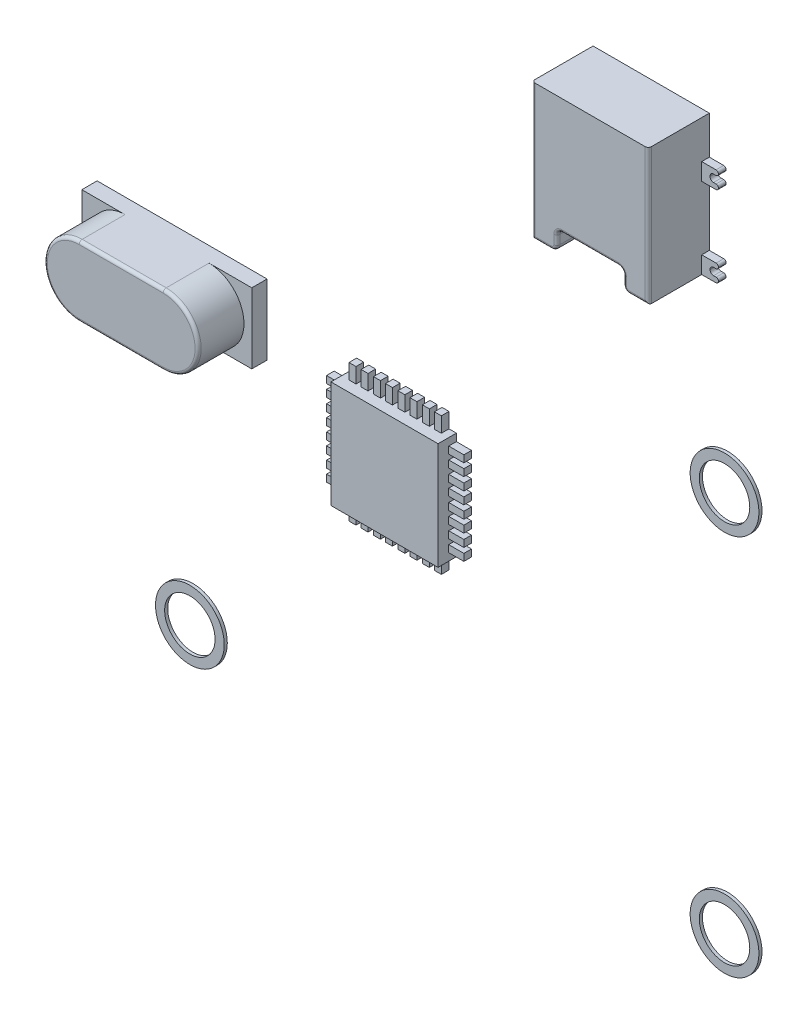
from build123d import *

# Parameters (mm, degrees)
AUFSATZ_LINEAR_AUSTRAGEN1_DEPTH       = 1
AUFSATZ_LINEAR_AUSTRAGEN2_DEPTH       = 4
AUFSATZ_LINEAR_AUSTRAGEN3_OUTLINE_W   = 0.4572
AUFSATZ_LINEAR_AUSTRAGEN3_OUTLINE_H   = 0.9906
AUFSATZ_LINEAR_AUSTRAGEN3_OUTLINE_W_2 = 0.9906
AUFSATZ_LINEAR_AUSTRAGEN3_OUTLINE_H_2 = 0.4572
AUFSATZ_LINEAR_AUSTRAGEN3_DEPTH       = 0.5
AUFSATZ_LINEAR_AUSTRAGEN4_DEPTH       = 1.2
AUFSATZ_LINEAR_AUSTRAGEN5_DEPTH       = 4
VERRUNDUNG1_R                         = 0.2
VERRUNDUNG2_R                         = 0.2
MODEL_7_R                             = 2.25
MODEL_7_R_2                           = 1.65
AUFSATZ_LINEAR_AUSTRAGEN6_DEPTH       = 0.2
AUFSATZ_LINEAR_AUSTRAGEN6_2_DEPTH     = 0.2
AUFSATZ_LINEAR_AUSTRAGEN6_3_DEPTH     = 0.2


# Read off the part's stored shape, not the designer's step: Aufsatz-Linear austragen1, Aufsatz-Linear austragen3
with BuildPart() as part:
    # Aufsatz-Linear austragen1 outline → Aufsatz-Linear austragen1 (new body)
    with BuildSketch(Plane.XY):
        with BuildLine():
            Line((24.854, 26.938), (22.054, 26.938))
            ThreePointArc((22.054, 26.938), (24.341533967, 24.638), (22.054, 22.338))
            Line((22.054, 22.338), (24.854, 22.338))
            Line((24.854, 22.338), (24.854, 26.938))
        make_face()
        with BuildLine():
            Line((13.729, 22.338), (16.554, 22.338))
            ThreePointArc((16.554, 22.338), (14.266466033, 24.638), (16.554, 26.938))
            Line((16.554, 26.938), (13.729, 26.938))
            Line((13.729, 26.938), (13.729, 22.338))
        make_face()
    extrude(amount=AUFSATZ_LINEAR_AUSTRAGEN1_DEPTH)

    # Model<3> → Aufsatz-Linear austragen2 (add)
    with BuildSketch(Plane.XY):
        with BuildLine():
            Line((22.054, 26.938), (16.579, 26.938))
            ThreePointArc((16.579, 26.938), (14.2665, 24.6505), (16.554, 22.338))
            Line((16.554, 22.338), (22.029, 22.338))
            ThreePointArc((22.029, 22.338), (24.3415, 24.6255), (22.054, 26.938))
        make_face()
    extrude(amount=AUFSATZ_LINEAR_AUSTRAGEN2_DEPTH)

    # Verrundung1
    verrundung1_edges = [part.edges().sort_by_distance(p)[0] for p in [
        (19.2915, 22.338, 4),
        (19.3165, 26.938, 4),
        (24.3415, 24.6255, 4),
        (14.2665, 24.6505, 4),
    ]]
    fillet(verrundung1_edges, radius=VERRUNDUNG1_R)


with BuildPart() as body_2:
    # Aufsatz-Linear austragen3 outline → Aufsatz-Linear austragen3 (new body)
    with BuildSketch(Plane.XY):
        with BuildLine():
            Line((53.8059, 48.3197), (53.8059, 47.1982))
            Line((53.8059, 47.1982), (54.7311, 47.1982))
            ThreePointArc((54.7311, 47.1982), (54.850032958, 47.247464518), (54.8993, 47.36639643))
            ThreePointArc((54.8993, 47.36639643), (54.854136082, 47.475433558), (54.7451, 47.5206))
            Line((54.7451, 47.5206), (54.5769, 47.5206))
            ThreePointArc((54.5769, 47.5206), (54.418241395, 47.586241395), (54.3526, 47.7449))
            Line((54.3526, 47.7449), (54.3526, 47.773))
            ThreePointArc((54.3526, 47.773), (54.418241395, 47.931658605), (54.5769, 47.9973))
            Line((54.5769, 47.9973), (54.7311, 47.9973))
            ThreePointArc((54.7311, 47.9973), (54.849998859, 48.04653043), (54.899299968, 48.1654))
            ThreePointArc((54.899299968, 48.1654), (54.854313056, 48.274712931), (54.7451, 48.3197))
            Line((54.7451, 48.3197), (53.8059, 48.3197))
        make_face()
        with BuildLine():
            ThreePointArc((54.5769, 42.2354), (54.418263825, 42.301063825), (54.3526, 42.4597))
            Line((54.3526, 42.4597), (54.3526, 42.4878))
            ThreePointArc((54.3526, 42.4878), (54.41829747, 42.64640253), (54.5769, 42.7121))
            Line((54.5769, 42.7121), (54.7311, 42.7121))
            ThreePointArc((54.7311, 42.7121), (54.85003422, 42.76136578), (54.8993, 42.8803))
            ThreePointArc((54.8993, 42.8803), (54.854251149, 42.989451149), (54.7451, 43.0345))
            Line((54.7451, 43.0345), (53.8059, 43.0345))
            Line((53.8059, 43.0345), (53.8059, 41.9131))
            Line((53.8059, 41.9131), (54.7311, 41.913))
            ThreePointArc((54.7311, 41.913), (54.850032958, 41.962264518), (54.8993, 42.08119643))
            ThreePointArc((54.8993, 42.08119643), (54.854136082, 42.190233558), (54.7451, 42.2354))
            Line((54.7451, 42.2354), (54.5769, 42.2354))
        make_face()
        with Locations((30.946, 16.8895)):
            Rectangle(AUFSATZ_LINEAR_AUSTRAGEN3_OUTLINE_W, AUFSATZ_LINEAR_AUSTRAGEN3_OUTLINE_H)
        with Locations((34.1464, 16.8895)):
            Rectangle(AUFSATZ_LINEAR_AUSTRAGEN3_OUTLINE_W, AUFSATZ_LINEAR_AUSTRAGEN3_OUTLINE_H)
        with Locations((35.7466, 16.8895)):
            Rectangle(AUFSATZ_LINEAR_AUSTRAGEN3_OUTLINE_W, AUFSATZ_LINEAR_AUSTRAGEN3_OUTLINE_H)
        with Locations((36.534, 16.8895)):
            Rectangle(AUFSATZ_LINEAR_AUSTRAGEN3_OUTLINE_W, AUFSATZ_LINEAR_AUSTRAGEN3_OUTLINE_H)
        with Locations((34.9338, 16.8895)):
            Rectangle(AUFSATZ_LINEAR_AUSTRAGEN3_OUTLINE_W, AUFSATZ_LINEAR_AUSTRAGEN3_OUTLINE_H)
        with Locations((33.3336, 16.8895)):
            Rectangle(AUFSATZ_LINEAR_AUSTRAGEN3_OUTLINE_W, AUFSATZ_LINEAR_AUSTRAGEN3_OUTLINE_H)
        with Locations((32.5462, 16.8895)):
            Rectangle(AUFSATZ_LINEAR_AUSTRAGEN3_OUTLINE_W, AUFSATZ_LINEAR_AUSTRAGEN3_OUTLINE_H)
        with Locations((31.7334, 16.8895)):
            Rectangle(AUFSATZ_LINEAR_AUSTRAGEN3_OUTLINE_W, AUFSATZ_LINEAR_AUSTRAGEN3_OUTLINE_H)
        with Locations((30.946, 24.8905)):
            Rectangle(AUFSATZ_LINEAR_AUSTRAGEN3_OUTLINE_W, AUFSATZ_LINEAR_AUSTRAGEN3_OUTLINE_H)
        with BuildLine():
            Line((46.1936, 47.1983), (46.1936, 48.317097005))
            Line((46.1936, 48.317097005), (45.268182624, 48.317097005))
            ThreePointArc((45.268182624, 48.317097005), (45.149245887, 48.267832602), (45.09997873, 48.148897005))
            ThreePointArc((45.09997873, 48.148897005), (45.14514391, 48.039862185), (45.25417873, 47.994697005))
            Line((45.25417873, 47.994697005), (45.42237873, 47.994697005))
            ThreePointArc((45.42237873, 47.994697005), (45.581014905, 47.92903318), (45.64667873, 47.770397005))
            Line((45.64667873, 47.770397005), (45.64667873, 47.742297005))
            ThreePointArc((45.64667873, 47.742297005), (45.58107098, 47.583604755), (45.42237873, 47.517997005))
            Line((45.42237873, 47.517997005), (45.26817873, 47.517997005))
            ThreePointArc((45.26817873, 47.517997005), (45.100864756, 47.365112576), (45.254296106, 47.1983))
            Line((45.254296106, 47.1983), (46.1936, 47.1983))
        make_face()
        with BuildLine():
            Line((46.1936, 41.9131), (46.1936, 43.0346))
            Line((46.1936, 43.0346), (45.2683, 43.0346))
            ThreePointArc((45.2683, 43.0346), (45.14936578, 42.98533422), (45.1001, 42.8664))
            ThreePointArc((45.1001, 42.8664), (45.14526518, 42.75736518), (45.2543, 42.7122))
            Line((45.2543, 42.7122), (45.4225, 42.7122))
            ThreePointArc((45.4225, 42.7122), (45.58110253, 42.64650253), (45.6468, 42.4879))
            Line((45.6468, 42.4879), (45.6468, 42.4598))
            ThreePointArc((45.6468, 42.4598), (45.58119225, 42.30110775), (45.4225, 42.2355))
            Line((45.4225, 42.2355), (45.2683, 42.2355))
            ThreePointArc((45.2683, 42.2355), (45.14936578, 42.18623422), (45.1001, 42.0673))
            ThreePointArc((45.1001, 42.0673), (45.145118035, 41.958118035), (45.2543, 41.9131))
            Line((45.2543, 41.9131), (46.1936, 41.9131))
        make_face()
        with Locations((29.7395, 20.4836)):
            Rectangle(AUFSATZ_LINEAR_AUSTRAGEN3_OUTLINE_W_2, AUFSATZ_LINEAR_AUSTRAGEN3_OUTLINE_H_2)
        with Locations((29.7395, 19.6962)):
            Rectangle(AUFSATZ_LINEAR_AUSTRAGEN3_OUTLINE_W_2, AUFSATZ_LINEAR_AUSTRAGEN3_OUTLINE_H_2)
        with Locations((29.7395, 18.8834)):
            Rectangle(AUFSATZ_LINEAR_AUSTRAGEN3_OUTLINE_W_2, AUFSATZ_LINEAR_AUSTRAGEN3_OUTLINE_H_2)
        with Locations((29.7395, 18.096)):
            Rectangle(AUFSATZ_LINEAR_AUSTRAGEN3_OUTLINE_W_2, AUFSATZ_LINEAR_AUSTRAGEN3_OUTLINE_H_2)
        with Locations((29.7395, 21.2964)):
            Rectangle(AUFSATZ_LINEAR_AUSTRAGEN3_OUTLINE_W_2, AUFSATZ_LINEAR_AUSTRAGEN3_OUTLINE_H_2)
        with Locations((29.7395, 22.0838)):
            Rectangle(AUFSATZ_LINEAR_AUSTRAGEN3_OUTLINE_W_2, AUFSATZ_LINEAR_AUSTRAGEN3_OUTLINE_H_2)
        with Locations((29.7395, 23.684)):
            Rectangle(AUFSATZ_LINEAR_AUSTRAGEN3_OUTLINE_W_2, AUFSATZ_LINEAR_AUSTRAGEN3_OUTLINE_H_2)
        with Locations((29.7395, 22.8966)):
            Rectangle(AUFSATZ_LINEAR_AUSTRAGEN3_OUTLINE_W_2, AUFSATZ_LINEAR_AUSTRAGEN3_OUTLINE_H_2)
        with Locations((37.7405, 20.4836)):
            Rectangle(AUFSATZ_LINEAR_AUSTRAGEN3_OUTLINE_W_2, AUFSATZ_LINEAR_AUSTRAGEN3_OUTLINE_H_2)
        with Locations((37.7405, 19.6962)):
            Rectangle(AUFSATZ_LINEAR_AUSTRAGEN3_OUTLINE_W_2, AUFSATZ_LINEAR_AUSTRAGEN3_OUTLINE_H_2)
        with Locations((37.7405, 18.8834)):
            Rectangle(AUFSATZ_LINEAR_AUSTRAGEN3_OUTLINE_W_2, AUFSATZ_LINEAR_AUSTRAGEN3_OUTLINE_H_2)
        with Locations((37.7405, 18.096)):
            Rectangle(AUFSATZ_LINEAR_AUSTRAGEN3_OUTLINE_W_2, AUFSATZ_LINEAR_AUSTRAGEN3_OUTLINE_H_2)
        with Locations((37.7405, 21.2964)):
            Rectangle(AUFSATZ_LINEAR_AUSTRAGEN3_OUTLINE_W_2, AUFSATZ_LINEAR_AUSTRAGEN3_OUTLINE_H_2)
        with Locations((37.7405, 22.0838)):
            Rectangle(AUFSATZ_LINEAR_AUSTRAGEN3_OUTLINE_W_2, AUFSATZ_LINEAR_AUSTRAGEN3_OUTLINE_H_2)
        with Locations((37.7405, 23.684)):
            Rectangle(AUFSATZ_LINEAR_AUSTRAGEN3_OUTLINE_W_2, AUFSATZ_LINEAR_AUSTRAGEN3_OUTLINE_H_2)
        with Locations((37.7405, 22.8966)):
            Rectangle(AUFSATZ_LINEAR_AUSTRAGEN3_OUTLINE_W_2, AUFSATZ_LINEAR_AUSTRAGEN3_OUTLINE_H_2)
        with Locations((31.7334, 24.8905)):
            Rectangle(AUFSATZ_LINEAR_AUSTRAGEN3_OUTLINE_W, AUFSATZ_LINEAR_AUSTRAGEN3_OUTLINE_H)
        with Locations((32.5462, 24.8905)):
            Rectangle(AUFSATZ_LINEAR_AUSTRAGEN3_OUTLINE_W, AUFSATZ_LINEAR_AUSTRAGEN3_OUTLINE_H)
        with Locations((33.3336, 24.8905)):
            Rectangle(AUFSATZ_LINEAR_AUSTRAGEN3_OUTLINE_W, AUFSATZ_LINEAR_AUSTRAGEN3_OUTLINE_H)
        with Locations((34.1464, 24.8905)):
            Rectangle(AUFSATZ_LINEAR_AUSTRAGEN3_OUTLINE_W, AUFSATZ_LINEAR_AUSTRAGEN3_OUTLINE_H)
        with Locations((34.9338, 24.8905)):
            Rectangle(AUFSATZ_LINEAR_AUSTRAGEN3_OUTLINE_W, AUFSATZ_LINEAR_AUSTRAGEN3_OUTLINE_H)
        with Locations((35.7466, 24.8905)):
            Rectangle(AUFSATZ_LINEAR_AUSTRAGEN3_OUTLINE_W, AUFSATZ_LINEAR_AUSTRAGEN3_OUTLINE_H)
        with Locations((36.534, 24.8905)):
            Rectangle(AUFSATZ_LINEAR_AUSTRAGEN3_OUTLINE_W, AUFSATZ_LINEAR_AUSTRAGEN3_OUTLINE_H)
    extrude(amount=AUFSATZ_LINEAR_AUSTRAGEN3_DEPTH)

    # Model<5> → Aufsatz-Linear austragen4 (add)
    with BuildSketch(Plane.XY):
        Polygon((30.2348, 17.8674), (30.2348, 17.3848), (30.7174, 17.3848), (31.1746, 17.3848), (31.5048, 17.3848), (31.962, 17.3848), (32.3176, 17.3848), (32.7748, 17.3848), (33.105, 17.3848), (33.5622, 17.3848), (33.9178, 17.3848), (34.375, 17.3848), (34.7052, 17.3848), (35.1624, 17.3848), (35.518, 17.3848), (35.9752, 17.3848), (36.3054, 17.3848), (36.7626, 17.3848), (37.2452, 17.3848), (37.2452, 17.8674), (37.2452, 18.3246), (37.2452, 18.6548), (37.2452, 19.112), (37.2452, 19.4676), (37.2452, 19.9248), (37.2452, 20.255), (37.2452, 20.7122), (37.2452, 21.0678), (37.2452, 21.525), (37.2452, 21.8552), (37.2452, 22.3124), (37.2452, 22.668), (37.2452, 23.1252), (37.2452, 23.4554), (37.2452, 23.9126), (37.2452, 24.3952), (36.7626, 24.3952), (36.3054, 24.3952), (35.9752, 24.3952), (35.518, 24.3952), (35.1624, 24.3952), (34.7052, 24.3952), (34.375, 24.3952), (33.9178, 24.3952), (33.5622, 24.3952), (33.105, 24.3952), (32.7748, 24.3952), (32.3176, 24.3952), (31.962, 24.3952), (31.5048, 24.3952), (31.1746, 24.3952), (30.7174, 24.3952), (30.2348, 24.3952), (30.2348, 23.9126), (30.2348, 23.4554), (30.2348, 23.1252), (30.2348, 22.668), (30.2348, 22.3124), (30.2348, 21.8552), (30.2348, 21.525), (30.2348, 21.0678), (30.2348, 20.7122), (30.2348, 20.255), (30.2348, 19.9248), (30.2348, 19.4676), (30.2348, 19.112), (30.2348, 18.6548), (30.2348, 18.3246), align=None)
    extrude(amount=AUFSATZ_LINEAR_AUSTRAGEN4_DEPTH)

    # Model<6> → Aufsatz-Linear austragen5 (add)
    with BuildSketch(Plane.XY):
        with BuildLine():
            Line((52.5442, 41.9131), (53.8059, 41.9131))
            Line((53.8059, 41.9131), (53.8059, 43.0345))
            Line((53.8059, 43.0345), (53.8059, 47.1982))
            Line((53.8059, 47.1982), (53.8059, 48.3197))
            Line((53.8059, 48.3197), (53.8059, 50.8151))
            Line((53.8059, 50.8151), (46.1936, 50.8151))
            Line((46.1936, 50.8151), (46.1936, 48.317097005))
            Line((46.1936, 48.317097005), (46.1936, 47.1983))
            Line((46.1936, 47.1983), (46.1936, 43.0346))
            Line((46.1936, 43.0346), (46.1936, 41.9131))
            Line((46.1936, 41.9131), (47.4693, 41.9131))
            ThreePointArc((47.4693, 41.9131), (47.7171736, 42.0157264), (47.8198, 42.2636))
            Line((47.8198, 42.2636), (47.8198, 42.8524))
            ThreePointArc((47.8198, 42.8524), (47.91423096, 43.08036904), (48.1422, 43.1748))
            Line((48.1422, 43.1748), (51.8152, 43.1748))
            ThreePointArc((51.8152, 43.1748), (52.07293795, 43.06803795), (52.1797, 42.8103))
            Line((52.1797, 42.8103), (52.1797, 42.2776))
            ThreePointArc((52.1797, 42.2776), (52.2864256, 42.0198256), (52.5442, 41.9131))
        make_face()
    extrude(amount=AUFSATZ_LINEAR_AUSTRAGEN5_DEPTH)

    # Verrundung2
    verrundung2_edges = [body_2.edges().sort_by_distance(p)[0] for p in [
        (53.17505, 41.9131, 4),
        (52.2864256, 42.0198256, 4),
        (52.1797, 42.54395, 4),
        (52.07293795, 43.06803795, 4),
        (46.83145, 41.9131, 4),
        (47.7171736, 42.0157264, 4),
        (47.8198, 42.558, 4),
        (47.91423096, 43.08036904, 4),
        (49.9787, 43.1748, 4),
        (46.1936, 46.3641, 4),
        (53.8059, 46.3641, 4),
    ]]
    fillet(verrundung2_edges, radius=VERRUNDUNG2_R)


with BuildPart() as body_3:
    # Model<7> → Aufsatz-Linear austragen6 (new body)
    with BuildSketch(Plane.XY):
        with Locations((55, 5)):
            Circle(MODEL_7_R)
        with Locations((55, 5)):
            Circle(MODEL_7_R_2, mode=Mode.SUBTRACT)
    extrude(amount=AUFSATZ_LINEAR_AUSTRAGEN6_DEPTH)


with BuildPart() as body_4:
    # Model<7> → Aufsatz-Linear austragen6 2 (new body)
    with BuildSketch(Plane.XY):
        with Locations((55, 30)):
            Circle(MODEL_7_R)
        with Locations((55, 30)):
            Circle(MODEL_7_R_2, mode=Mode.SUBTRACT)
    extrude(amount=AUFSATZ_LINEAR_AUSTRAGEN6_2_DEPTH)


with BuildPart() as body_5:
    # Model<7> → Aufsatz-Linear austragen6 3 (new body)
    with BuildSketch(Plane.XY):
        with Locations((20, 5)):
            Circle(MODEL_7_R)
        with Locations((20, 5)):
            Circle(MODEL_7_R_2, mode=Mode.SUBTRACT)
    extrude(amount=AUFSATZ_LINEAR_AUSTRAGEN6_3_DEPTH)


solid = Compound([part.part, body_2.part, body_3.part, body_4.part, body_5.part])
